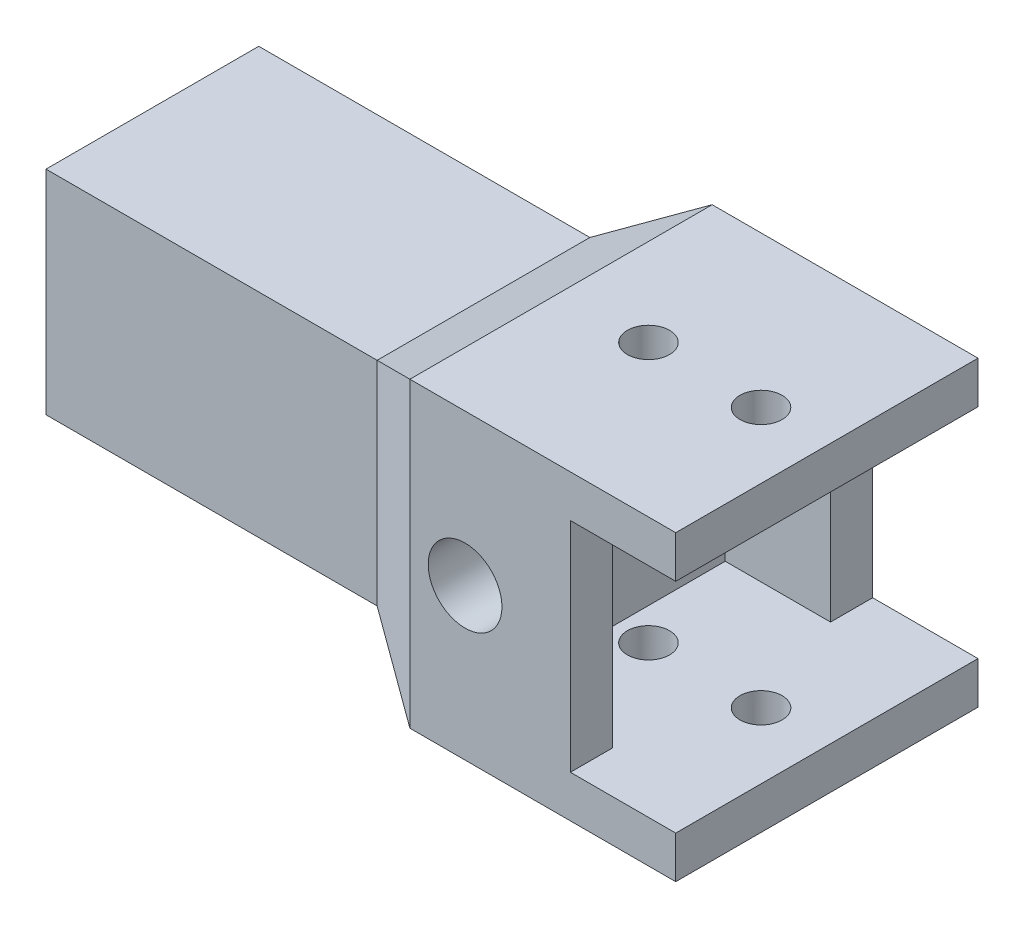
from build123d import *

# Parameters (mm, degrees)
SKETCH1_W                 = 20
SKETCH1_H                 = 20
BOSS_EXTRUDE1_DEPTH       = 20
SKETCH2_W                 = 20
SKETCH2_H                 = 40.2
BOSS_EXTRUDE2_DEPTH       = 64.7
SKETCH3_W                 = 40.9
SKETCH3_H                 = 20.8
CUT_EXTRUDE1_DEPTH        = 90.320210479
SKETCH4_W                 = 11.9
SKETCH4_H                 = 40.2
CUT_EXTRUDE2_DEPTH        = 90.320210479
SKETCH5_R                 = 2.35
CUT_EXTRUDE3_DEPTH        = 10
SKETCH6_R                 = 2.35
CUT_EXTRUDE4_DEPTH        = 10
CHAMFER1_SIZE             = 1
SKETCH7_W                 = 20
SKETCH7_H                 = 10.1
BOSS_EXTRUDE4_DEPTH       = 4.7
SKETCH9_W                 = 20
SKETCH9_H                 = 20
BOSS_EXTRUDE5_DEPTH       = 24.7
SKETCH10_R                = 3
CUT_EXTRUDE5_DEPTH        = 2
FILLET1_R                 = 3.23
SKETCH11_W                = 20.2
SKETCH11_H                = 20.2
SKETCH11_W_2              = 20
SKETCH11_H_2              = 20
BOSS_EXTRUDE6_DEPTH       = 40
SKETCH12_R                = 3.35
BOSS_EXTRUDE7_DEPTH       = 0.1
BOSS_EXTRUDE8_DEPTH       = 0.1
SKETCH14_W                = 27.84115355
SKETCH14_H                = 50.628320261
CUT_EXTRUDE6_DEPTH        = 57.5
BOSS_EXTRUDE10_DEPTH      = 10
BOSS_EXTRUDE10_DEPTH_BACK = 0.96
SKETCH18_W                = 28.7
SKETCH18_H                = 28.7
SKETCH18_W_2              = 20.7
SKETCH18_H_2              = 20.7
SKETCH19_W                = 20.7
SKETCH19_H                = 20.7
BOSS_EXTRUDE11_DEPTH      = 4.04
SKETCH21_W                = 20.7
SKETCH21_H                = 20.7
BOSS_EXTRUDE13_DEPTH      = 0.96
SKETCH22_W                = 28.7
SKETCH22_H                = 28.7
SKETCH22_W_2              = 20.7
SKETCH22_H_2              = 20.7
BOSS_EXTRUDE14_DEPTH      = 14.04
CHAMFER2_SIZE             = 4.387862046
CHAMFER2_SIZE_2           = 7.6
SKETCH24_R                = 3.5
CUT_EXTRUDE7_DEPTH        = 51.76660418
SKETCH25_W                = 4
SKETCH25_H                = 20.7
CUT_EXTRUDE8_DEPTH        = 10
SKETCH26_R                = 2
CUT_EXTRUDE9_DEPTH        = 51.76660418


with BuildPart() as part:
    # Sketch1 → Boss-Extrude1 (new body)
    with BuildSketch(Plane(origin=(0, 0, 0), x_dir=(0, 0, -1), z_dir=(1, 0, 0))):
        Rectangle(SKETCH1_W, SKETCH1_H)
    extrude(amount=BOSS_EXTRUDE1_DEPTH)

    # Sketch2 → Boss-Extrude2 (add)
    with BuildSketch(Plane(origin=(20, 0, 0), x_dir=(0, 0, -1), z_dir=(1, 0, 0))):
        Rectangle(SKETCH2_W, SKETCH2_H)
    extrude(amount=BOSS_EXTRUDE2_DEPTH)

    # Sketch3 → Cut-Extrude1 (cut, through all)
    with BuildSketch(Plane.XY.offset(10)):
        with Locations((52.35, 0)):
            Rectangle(SKETCH3_W, SKETCH3_H)
    extrude(amount=-CUT_EXTRUDE1_DEPTH, mode=Mode.SUBTRACT)

    # Sketch4 → Cut-Extrude2 (cut, through all)
    with BuildSketch(Plane.XY.offset(10)):
        with Locations((78.75, 0)):
            Rectangle(SKETCH4_W, SKETCH4_H)
    extrude(amount=-CUT_EXTRUDE2_DEPTH, mode=Mode.SUBTRACT)

    # Sketch5 → Cut-Extrude3 (cut)
    with BuildSketch(Plane.XY.offset(10)):
        with Locations((28.01, 4.9)):
            Circle(SKETCH5_R)
        with Locations(Location((28.01, -4.9, 0), (0, 0, 180))):
            Circle(SKETCH5_R)
    extrude(amount=-CUT_EXTRUDE3_DEPTH, mode=Mode.SUBTRACT)

    # Sketch6 → Cut-Extrude4 (cut)
    with BuildSketch(Plane(origin=(72.8, 0, 0), x_dir=(0, 0, -1), z_dir=(1, 0, 0))):
        with Locations((0, -15.25)):
            Circle(SKETCH6_R)
        with Locations(Location((0, 15.25, 0), (0, 0, 180))):
            Circle(SKETCH6_R)
    extrude(amount=-CUT_EXTRUDE4_DEPTH, mode=Mode.SUBTRACT)

    # Chamfer1
    chamfer1_edges = [part.edges().sort_by_distance(p)[0] for p in [
        (25.66, 4.9, 10),
        (30.36, -4.9, 10),
        (72.8, -15.25, 2.35),
        (72.8, 15.25, -2.35),
    ]]
    chamfer(chamfer1_edges, length=CHAMFER1_SIZE)

    # Sketch7 → Boss-Extrude4 (add)
    with BuildSketch(Plane.ZY.offset(-20)):
        with Locations((0, 15.05)):
            Rectangle(SKETCH7_W, SKETCH7_H)
        with Locations((0, -15.05)):
            Rectangle(SKETCH7_W, SKETCH7_H)
    extrude(amount=BOSS_EXTRUDE4_DEPTH)

    # Sketch9 → Boss-Extrude5 (add)
    with BuildSketch(Plane.ZY):
        Rectangle(SKETCH9_W, SKETCH9_H)
    extrude(amount=BOSS_EXTRUDE5_DEPTH)

    # Sketch10 → Cut-Extrude5 (cut)
    with BuildSketch(Plane.ZY.offset(24.7)):
        Circle(SKETCH10_R)
    extrude(amount=-CUT_EXTRUDE5_DEPTH, mode=Mode.SUBTRACT)

    # Fillet1
    # the kernel refuses this fillet: 3.23 mm, written as the material it adds along each edge
    with BuildSketch(Plane(origin=(-22.7, 0, 0), x_dir=(0, 0, 1), z_dir=(0, -1, 0))) as fillet1_piece_1:
        with BuildLine():
            CenterArc((0.013363095, 3.23), FILLET1_R, 270, 67.616447755)
            Line((0.013363095, 0), (0.013363095, -0.0646))
            Line((0.013363095, -0.0646), (3, -0.0646))
            Line((3, -0.0646), (3.0646, 0))
            ThreePointArc((3.0646, 0), (3.0646, 1), (3.059732738, 1.9754))
            Line((3.059732738, 1.9754), (3, 2))
        make_face()
    revolve(axis=Axis((-22.7, 0, 0), (-1, 0, 0)))

    # Sketch11 → Boss-Extrude6 (add)
    with BuildSketch(Plane.ZY.offset(24.7)):
        Rectangle(SKETCH11_W, SKETCH11_H)
        Rectangle(SKETCH11_W_2, SKETCH11_H_2, mode=Mode.SUBTRACT)
    extrude(amount=-BOSS_EXTRUDE6_DEPTH)

    # Sketch12 → Boss-Extrude7 (add)
    with BuildSketch(Plane.XY.offset(10)):
        Polygon((72.8, 20.1), (15.3, 20.1), (15.3, -20.1), (72.8, -20.1), (72.8, -10.4), (31.9, -10.4), (31.9, 10.4), (72.8, 10.4), align=None)
        with Locations(Location((28.01, 4.9, 0), (0, 0, 180))):
            Circle(SKETCH12_R, mode=Mode.SUBTRACT)
        with Locations(Location((28.01, -4.9, 0), (0, 0, 180))):
            Circle(SKETCH12_R, mode=Mode.SUBTRACT)
    extrude(amount=BOSS_EXTRUDE7_DEPTH)

    # Sketch13 → Boss-Extrude8 (add)
    with BuildSketch(Plane(origin=(0, 0, -10), x_dir=(-1, 0, 0), z_dir=(0, 0, -1))):
        Polygon((-72.8, -20.1), (-15.3, -20.1), (-15.3, 20.1), (-72.8, 20.1), (-72.8, 10.4), (-31.9, 10.4), (-31.9, -10.4), (-72.8, -10.4), align=None)
    extrude(amount=BOSS_EXTRUDE8_DEPTH)

    # Sketch14 → Cut-Extrude6 (cut)
    with BuildSketch(Plane(origin=(72.8, 0, 0), x_dir=(0, 0, -1), z_dir=(1, 0, 0))):
        with Locations((-1.3978782, 0.184476051)):
            Rectangle(SKETCH14_W, SKETCH14_H)
    extrude(amount=-CUT_EXTRUDE6_DEPTH, mode=Mode.SUBTRACT)

    # Sketch19 → Boss-Extrude11 (add)
    with BuildSketch(Plane(origin=(15.3, 0, 0), x_dir=(0, 0, -1), z_dir=(1, 0, 0))):
        Rectangle(SKETCH19_W, SKETCH19_H)
    extrude(amount=BOSS_EXTRUDE11_DEPTH)



with BuildPart() as body_2:
    # Sketch18 → Boss-Extrude10 (new, two sides: drawn at the far end of the back side and taken through both)
    with BuildSketch(Plane(origin=(15.3, 0, 0), x_dir=(0, 0, -1), z_dir=(1, 0, 0)).offset(-BOSS_EXTRUDE10_DEPTH_BACK)):
        Rectangle(SKETCH18_W, SKETCH18_H)
        Rectangle(SKETCH18_W_2, SKETCH18_H_2, mode=Mode.SUBTRACT)
    extrude(amount=BOSS_EXTRUDE10_DEPTH + BOSS_EXTRUDE10_DEPTH_BACK)


with BuildPart() as part_1:
    add(part.part)

    add(body_2.part)  # Boss-Extrude13 merges body 2
    # Sketch21 → Boss-Extrude13 (add)
    with BuildSketch(Plane.ZY.offset(-15.3)):
        Rectangle(SKETCH21_W, SKETCH21_H)
    extrude(amount=BOSS_EXTRUDE13_DEPTH)

    # Sketch22 → Boss-Extrude14 (add)
    with BuildSketch(Plane(origin=(25.3, 0, 0), x_dir=(0, 0, -1), z_dir=(1, 0, 0))):
        Rectangle(SKETCH22_W, SKETCH22_H)
        Rectangle(SKETCH22_W_2, SKETCH22_H_2, mode=Mode.SUBTRACT)
    extrude(amount=BOSS_EXTRUDE14_DEPTH)

    # Chamfer2
    # the kernel refuses this chamfer: 7.6, 4.387862046 mm, written as the material it adds along each edge
    with BuildSketch(Plane(origin=(14.34, -10.1, 10.1), x_dir=(0.05789386240267072, -0.9983227437537925, 0), z_dir=(0, 0, -1))) as chamfer2_piece_1_section:
        Polygon((CHAMFER2_SIZE * 0.998322743718, CHAMFER2_SIZE * 0.0578938624006), (-CHAMFER2_SIZE_2 * 0.0578938624027, CHAMFER2_SIZE_2 * 0.998322743754), (0, 0), align=None)
    chamfer2_piece_1 = extrude(amount=20.2, mode=Mode.PRIVATE)
    chamfer2_piece_1 = split(chamfer2_piece_1, bisect_by=Plane(origin=(11.775225799, -14.35, 0), z_dir=(0, 1, 0)), keep=Keep.TOP, mode=Mode.PRIVATE)
    add(chamfer2_piece_1)
    with BuildSketch(Plane(origin=(14.34, -10.1, -10.1), x_dir=(0.05789386240267072, 0, -0.9983227437537925), z_dir=(0, 1, 0))) as chamfer2_piece_2_section:
        Polygon((CHAMFER2_SIZE * 0.998322743718, CHAMFER2_SIZE * 0.0578938624006), (-CHAMFER2_SIZE_2 * 0.0578938624027, CHAMFER2_SIZE_2 * 0.998322743754), (0, 0), align=None)
    chamfer2_piece_2 = extrude(amount=20.2, mode=Mode.PRIVATE)
    chamfer2_piece_2 = split(chamfer2_piece_2, bisect_by=Plane(origin=(11.775225799, 0, -14.35), z_dir=(0, 0, 1)), keep=Keep.TOP, mode=Mode.PRIVATE)
    add(chamfer2_piece_2)
    with BuildSketch(Plane(origin=(14.34, 10.1, -10.1), x_dir=(0.05789386240267072, 0.9983227437537925, 0), z_dir=(0, 0, 1))) as chamfer2_piece_3_section:
        Polygon((CHAMFER2_SIZE * 0.998322743718, CHAMFER2_SIZE * 0.0578938624006), (-CHAMFER2_SIZE_2 * 0.0578938624027, CHAMFER2_SIZE_2 * 0.998322743754), (0, 0), align=None)
    chamfer2_piece_3 = extrude(amount=20.2, mode=Mode.PRIVATE)
    chamfer2_piece_3 = split(chamfer2_piece_3, bisect_by=Plane(origin=(11.775225799, 14.35, 0), z_dir=(0, -1, 0)), keep=Keep.TOP, mode=Mode.PRIVATE)
    add(chamfer2_piece_3)
    with BuildSketch(Plane(origin=(14.34, 10.1, 10.1), x_dir=(0.05789386240267072, 0, 0.9983227437537925), z_dir=(0, -1, 0))) as chamfer2_piece_4_section:
        Polygon((CHAMFER2_SIZE * 0.998322743718, CHAMFER2_SIZE * 0.0578938624006), (-CHAMFER2_SIZE_2 * 0.0578938624027, CHAMFER2_SIZE_2 * 0.998322743754), (0, 0), align=None)
    chamfer2_piece_4 = extrude(amount=20.2, mode=Mode.PRIVATE)
    chamfer2_piece_4 = split(chamfer2_piece_4, bisect_by=Plane(origin=(11.775225799, 0, 14.35), z_dir=(0, 0, -1)), keep=Keep.TOP, mode=Mode.PRIVATE)
    add(chamfer2_piece_4)
    with BuildSketch(Plane(origin=(14.34, 10.1, 10.1), x_dir=(0.05789386240267072, 0, 0.9983227437537925), z_dir=(0, -1, 0))) as chamfer2_piece_5a_section:
        Polygon((CHAMFER2_SIZE * 0.998322743718, CHAMFER2_SIZE * 0.0578938624006), (-CHAMFER2_SIZE_2 * 0.0578938624027, CHAMFER2_SIZE_2 * 0.998322743754), (0, 0), align=None)
    chamfer2_piece_5a = extrude(amount=39.861851735, mode=Mode.PRIVATE)
    chamfer2_piece_5a = split(chamfer2_piece_5a, bisect_by=Plane(origin=(11.775225799, -14.35, 11.489810432), z_dir=(0, 1, 0)), keep=Keep.TOP, mode=Mode.PRIVATE)
    chamfer2_piece_5a = split(chamfer2_piece_5a, bisect_by=Plane(origin=(11.775225799, -12.225, 14.35), z_dir=(0, 0, -1)), keep=Keep.TOP, mode=Mode.PRIVATE)
    chamfer2_piece_5a = split(chamfer2_piece_5a, bisect_by=Plane(origin=(11.775225799, -10.1, 11.489810432), z_dir=(0, -1, 0)), keep=Keep.TOP, mode=Mode.PRIVATE)
    with BuildSketch(Plane(origin=(14.34, -10.1, 29.761851735), x_dir=(0.05789386240267072, -0.9983227437537925, 0), z_dir=(0, 0, -1))) as chamfer2_piece_5b_section:
        Polygon((CHAMFER2_SIZE * 0.998322743718, CHAMFER2_SIZE * 0.0578938624006), (-CHAMFER2_SIZE_2 * 0.0578938624027, CHAMFER2_SIZE_2 * 0.998322743754), (0, 0), align=None)
    chamfer2_piece_5b = extrude(amount=39.861851735, mode=Mode.PRIVATE)
    chamfer2_piece_5b = split(chamfer2_piece_5b, bisect_by=Plane(origin=(11.775225799, -14.35, 12.225), z_dir=(0, 1, 0)), keep=Keep.TOP, mode=Mode.PRIVATE)
    chamfer2_piece_5b = split(chamfer2_piece_5b, bisect_by=Plane(origin=(11.775225799, -11.489810432, 14.35), z_dir=(0, 0, -1)), keep=Keep.TOP, mode=Mode.PRIVATE)
    chamfer2_piece_5b = split(chamfer2_piece_5b, bisect_by=Plane(origin=(11.775225799, -11.489810432, 10.1), z_dir=(0, 0, 1)), keep=Keep.TOP, mode=Mode.PRIVATE)
    chamfer2_piece_5 = chamfer2_piece_5a & chamfer2_piece_5b
    add(chamfer2_piece_5)
    with BuildSketch(Plane(origin=(14.34, -10.1, 10.1), x_dir=(0.05789386240267072, -0.9983227437537925, 0), z_dir=(0, 0, -1))) as chamfer2_piece_6a_section:
        Polygon((CHAMFER2_SIZE * 0.998322743718, CHAMFER2_SIZE * 0.0578938624006), (-CHAMFER2_SIZE_2 * 0.0578938624027, CHAMFER2_SIZE_2 * 0.998322743754), (0, 0), align=None)
    chamfer2_piece_6a = extrude(amount=39.861851735, mode=Mode.PRIVATE)
    chamfer2_piece_6a = split(chamfer2_piece_6a, bisect_by=Plane(origin=(11.775225799, -11.489810432, -14.35), z_dir=(0, 0, 1)), keep=Keep.TOP, mode=Mode.PRIVATE)
    chamfer2_piece_6a = split(chamfer2_piece_6a, bisect_by=Plane(origin=(11.775225799, -14.35, -12.225), z_dir=(0, 1, 0)), keep=Keep.TOP, mode=Mode.PRIVATE)
    chamfer2_piece_6a = split(chamfer2_piece_6a, bisect_by=Plane(origin=(11.775225799, -11.489810432, -10.1), z_dir=(0, 0, -1)), keep=Keep.TOP, mode=Mode.PRIVATE)
    with BuildSketch(Plane(origin=(14.34, -29.761851735, -10.1), x_dir=(0.05789386240267072, 0, -0.9983227437537925), z_dir=(0, 1, 0))) as chamfer2_piece_6b_section:
        Polygon((CHAMFER2_SIZE * 0.998322743718, CHAMFER2_SIZE * 0.0578938624006), (-CHAMFER2_SIZE_2 * 0.0578938624027, CHAMFER2_SIZE_2 * 0.998322743754), (0, 0), align=None)
    chamfer2_piece_6b = extrude(amount=39.861851735, mode=Mode.PRIVATE)
    chamfer2_piece_6b = split(chamfer2_piece_6b, bisect_by=Plane(origin=(11.775225799, -12.225, -14.35), z_dir=(0, 0, 1)), keep=Keep.TOP, mode=Mode.PRIVATE)
    chamfer2_piece_6b = split(chamfer2_piece_6b, bisect_by=Plane(origin=(11.775225799, -14.35, -11.489810432), z_dir=(0, 1, 0)), keep=Keep.TOP, mode=Mode.PRIVATE)
    chamfer2_piece_6b = split(chamfer2_piece_6b, bisect_by=Plane(origin=(11.775225799, -10.1, -11.489810432), z_dir=(0, -1, 0)), keep=Keep.TOP, mode=Mode.PRIVATE)
    chamfer2_piece_6 = chamfer2_piece_6a & chamfer2_piece_6b
    add(chamfer2_piece_6)
    with BuildSketch(Plane(origin=(14.34, -10.1, -10.1), x_dir=(0.05789386240267072, 0, -0.9983227437537925), z_dir=(0, 1, 0))) as chamfer2_piece_7a_section:
        Polygon((CHAMFER2_SIZE * 0.998322743718, CHAMFER2_SIZE * 0.0578938624006), (-CHAMFER2_SIZE_2 * 0.0578938624027, CHAMFER2_SIZE_2 * 0.998322743754), (0, 0), align=None)
    chamfer2_piece_7a = extrude(amount=39.861851735, mode=Mode.PRIVATE)
    chamfer2_piece_7a = split(chamfer2_piece_7a, bisect_by=Plane(origin=(11.775225799, 12.225, -14.35), z_dir=(0, 0, 1)), keep=Keep.TOP, mode=Mode.PRIVATE)
    chamfer2_piece_7a = split(chamfer2_piece_7a, bisect_by=Plane(origin=(11.775225799, 14.35, -11.489810432), z_dir=(0, -1, 0)), keep=Keep.TOP, mode=Mode.PRIVATE)
    chamfer2_piece_7a = split(chamfer2_piece_7a, bisect_by=Plane(origin=(11.775225799, 10.1, -11.489810432), z_dir=(0, 1, 0)), keep=Keep.TOP, mode=Mode.PRIVATE)
    with BuildSketch(Plane(origin=(14.34, 10.1, -29.761851735), x_dir=(0.05789386240267072, 0.9983227437537925, 0), z_dir=(0, 0, 1))) as chamfer2_piece_7b_section:
        Polygon((CHAMFER2_SIZE * 0.998322743718, CHAMFER2_SIZE * 0.0578938624006), (-CHAMFER2_SIZE_2 * 0.0578938624027, CHAMFER2_SIZE_2 * 0.998322743754), (0, 0), align=None)
    chamfer2_piece_7b = extrude(amount=39.861851735, mode=Mode.PRIVATE)
    chamfer2_piece_7b = split(chamfer2_piece_7b, bisect_by=Plane(origin=(11.775225799, 11.489810432, -14.35), z_dir=(0, 0, 1)), keep=Keep.TOP, mode=Mode.PRIVATE)
    chamfer2_piece_7b = split(chamfer2_piece_7b, bisect_by=Plane(origin=(11.775225799, 14.35, -12.225), z_dir=(0, -1, 0)), keep=Keep.TOP, mode=Mode.PRIVATE)
    chamfer2_piece_7b = split(chamfer2_piece_7b, bisect_by=Plane(origin=(11.775225799, 11.489810432, -10.1), z_dir=(0, 0, -1)), keep=Keep.TOP, mode=Mode.PRIVATE)
    chamfer2_piece_7 = chamfer2_piece_7a & chamfer2_piece_7b
    add(chamfer2_piece_7)
    with BuildSketch(Plane(origin=(14.34, 29.761851735, 10.1), x_dir=(0.05789386240267072, 0, 0.9983227437537925), z_dir=(0, -1, 0))) as chamfer2_piece_8a_section:
        Polygon((CHAMFER2_SIZE * 0.998322743718, CHAMFER2_SIZE * 0.0578938624006), (-CHAMFER2_SIZE_2 * 0.0578938624027, CHAMFER2_SIZE_2 * 0.998322743754), (0, 0), align=None)
    chamfer2_piece_8a = extrude(amount=39.861851735, mode=Mode.PRIVATE)
    chamfer2_piece_8a = split(chamfer2_piece_8a, bisect_by=Plane(origin=(11.775225799, 12.225, 14.35), z_dir=(0, 0, -1)), keep=Keep.TOP, mode=Mode.PRIVATE)
    chamfer2_piece_8a = split(chamfer2_piece_8a, bisect_by=Plane(origin=(11.775225799, 14.35, 11.489810432), z_dir=(0, -1, 0)), keep=Keep.TOP, mode=Mode.PRIVATE)
    chamfer2_piece_8a = split(chamfer2_piece_8a, bisect_by=Plane(origin=(11.775225799, 10.1, 11.489810432), z_dir=(0, 1, 0)), keep=Keep.TOP, mode=Mode.PRIVATE)
    with BuildSketch(Plane(origin=(14.34, 10.1, -10.1), x_dir=(0.05789386240267072, 0.9983227437537925, 0), z_dir=(0, 0, 1))) as chamfer2_piece_8b_section:
        Polygon((CHAMFER2_SIZE * 0.998322743718, CHAMFER2_SIZE * 0.0578938624006), (-CHAMFER2_SIZE_2 * 0.0578938624027, CHAMFER2_SIZE_2 * 0.998322743754), (0, 0), align=None)
    chamfer2_piece_8b = extrude(amount=39.861851735, mode=Mode.PRIVATE)
    chamfer2_piece_8b = split(chamfer2_piece_8b, bisect_by=Plane(origin=(11.775225799, 11.489810432, 14.35), z_dir=(0, 0, -1)), keep=Keep.TOP, mode=Mode.PRIVATE)
    chamfer2_piece_8b = split(chamfer2_piece_8b, bisect_by=Plane(origin=(11.775225799, 14.35, 12.225), z_dir=(0, -1, 0)), keep=Keep.TOP, mode=Mode.PRIVATE)
    chamfer2_piece_8b = split(chamfer2_piece_8b, bisect_by=Plane(origin=(11.775225799, 11.489810432, 10.1), z_dir=(0, 0, 1)), keep=Keep.TOP, mode=Mode.PRIVATE)
    chamfer2_piece_8 = chamfer2_piece_8a & chamfer2_piece_8b
    add(chamfer2_piece_8)

    # Sketch24 → Cut-Extrude7 (cut, through all)
    with BuildSketch(Plane.XY.offset(14.35)):
        with Locations((19.34, 0)):
            Circle(SKETCH24_R)
    extrude(amount=-CUT_EXTRUDE7_DEPTH, mode=Mode.SUBTRACT)

    # Sketch25 → Cut-Extrude8 (cut)
    with BuildSketch(Plane(origin=(39.34, 0, 0), x_dir=(0, 0, -1), z_dir=(1, 0, 0))):
        with Locations((-12.35, 0)):
            Rectangle(SKETCH25_W, SKETCH25_H)
        with Locations((12.35, 0)):
            Rectangle(SKETCH25_W, SKETCH25_H)
    extrude(amount=-CUT_EXTRUDE8_DEPTH, mode=Mode.SUBTRACT)

    # Sketch26 → Cut-Extrude9 (cut, through all)
    with BuildSketch(Plane(origin=(0, 14.35, 0), x_dir=(1, 0, 0), z_dir=(0, 1, 0))):
        with Locations(Location((33.09, 0, 0), (0, 0, 270))):
            Circle(SKETCH26_R)
        with Locations(Location((22.401215932, 0, 0), (0, 0, 270))):
            Circle(SKETCH26_R)
    extrude(amount=-CUT_EXTRUDE9_DEPTH, mode=Mode.SUBTRACT)


solid = part_1.part
